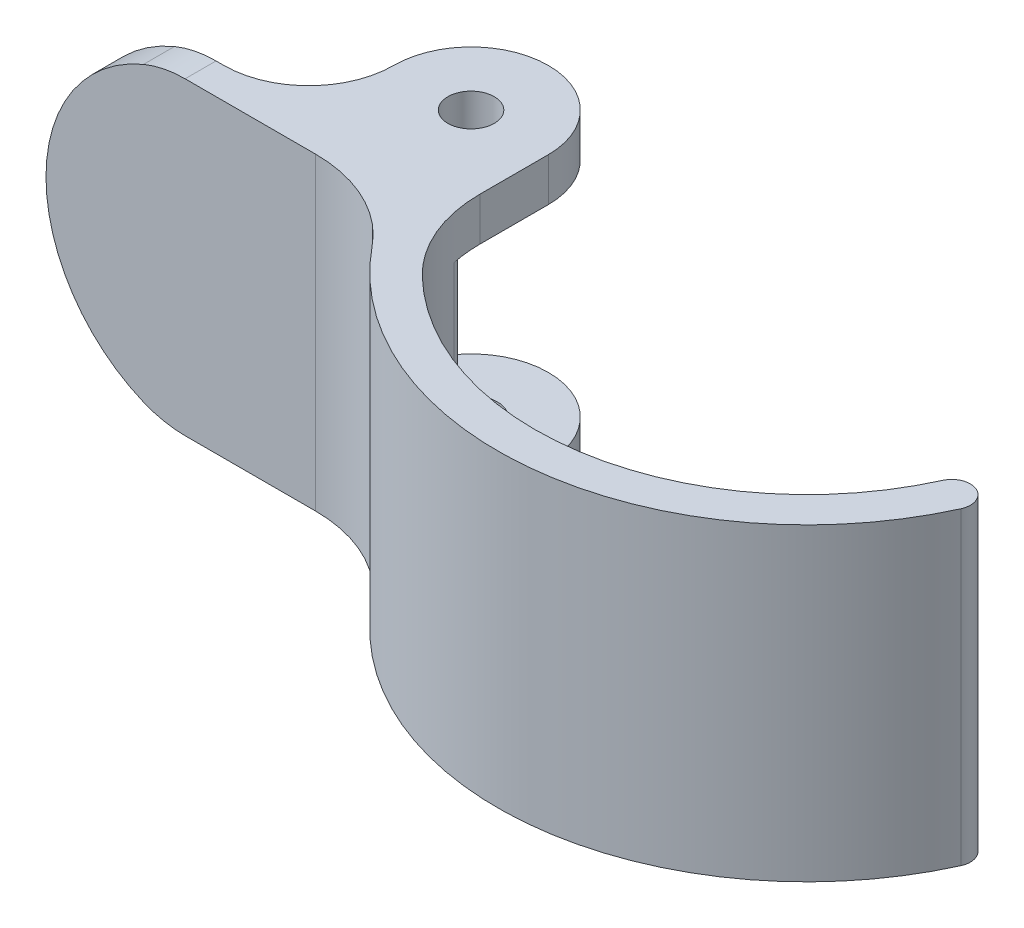
from build123d import *

# Parameters (mm, degrees)
SKETCH1_W                                           = 17
SKETCH1_H                                           = 20
BOSS_EXTRUDE1_DEPTH                                 = 2
SKETCH2_R                                           = 1.5
BOSS_EXTRUDE2_DEPTH                                 = 2.8
FILLET1_R                                           = 5.5
FILLET1_OF_MIRROR1_R                                = 5.5
CSK_FOR_M3_COUNTERSUNK_FLAT_HEAD_SCREW1_D           = 3.4
CSK_FOR_M3_COUNTERSUNK_FLAT_HEAD_SCREW1_DEPTH       = 7
CSK_FOR_M3_COUNTERSUNK_FLAT_HEAD_SCREW1_CSINK_D     = 6.3
CSK_FOR_M3_COUNTERSUNK_FLAT_HEAD_SCREW1_CSINK_ANGLE = 90
CSK_FOR_M3_COUNTERSUNK_FLAT_HEAD_SCREW1_TIP         = 1.021463052
BOSS_EXTRUDE3_DEPTH                                 = 2
FILLET2_R                                           = 7
BOSS_EXTRUDE4_DEPTH                                 = 20
FILLET3_R                                           = 9
FILLET4_R                                           = 9
FILLET5_R                                           = 1


# Some blends are built 0.0001 mm under size
with BuildPart() as part:
    # Sketch1 → Boss-Extrude1 (new body)
    with BuildSketch(Plane.XY):
        with Locations((-3.5, 0)):
            Rectangle(SKETCH1_W, SKETCH1_H)
    extrude(amount=BOSS_EXTRUDE1_DEPTH)

    # Sketch2 → Boss-Extrude2 (add)
    with BuildSketch(Plane(origin=(0, 10, 0), x_dir=(1, 0, 0), z_dir=(0, 1, 0))):
        with BuildLine():
            Line((5, 0), (-5, 0))
            Line((-5, 0), (-5, 5.5))
            ThreePointArc((-5, 5.5), (0, 10.5), (5, 5.5))
            Line((5, 5.5), (5, 0))
        make_face()
        with Locations(Location((0, 5.5, 0), (0, 0, 270))):
            Circle(SKETCH2_R, mode=Mode.SUBTRACT)
    boss_extrude2 = extrude(amount=-BOSS_EXTRUDE2_DEPTH)

    # Fillet1
    fillet1_edges = [part.edges().sort_by_distance(p)[0] for p in [
        (-5, 8.6, 0),
    ]]
    fillet(fillet1_edges, radius=FILLET1_R - 0.0001)  # a hair under: the kernel refuses the full size

    # Mirror1: Boss-Extrude2 across plane
    add(boss_extrude2.mirror(Plane.ZX))

    # Fillet1 of Mirror1
    fillet1_of_mirror1_edges = [part.edges().sort_by_distance(p)[0] for p in [
        (-5, -8.6, 0),
    ]]
    fillet(fillet1_of_mirror1_edges, radius=FILLET1_OF_MIRROR1_R - 0.0001)  # a hair under: the kernel refuses the full size

    # CSK for M3 Countersunk Flat Head Screw1
    with Locations(Plane(origin=(0, -10, 0), x_dir=(-1, 0, 0), z_dir=(0, -1, 0))):
        with Locations((0, 5.5)):
            CounterSinkHole(CSK_FOR_M3_COUNTERSUNK_FLAT_HEAD_SCREW1_D / 2, CSK_FOR_M3_COUNTERSUNK_FLAT_HEAD_SCREW1_CSINK_D / 2, depth=CSK_FOR_M3_COUNTERSUNK_FLAT_HEAD_SCREW1_DEPTH, counter_sink_angle=CSK_FOR_M3_COUNTERSUNK_FLAT_HEAD_SCREW1_CSINK_ANGLE)
            with Locations((0, 0, -(CSK_FOR_M3_COUNTERSUNK_FLAT_HEAD_SCREW1_DEPTH + CSK_FOR_M3_COUNTERSUNK_FLAT_HEAD_SCREW1_TIP / 2))):  # 118° drill point
                Cone(0, CSK_FOR_M3_COUNTERSUNK_FLAT_HEAD_SCREW1_D / 2, CSK_FOR_M3_COUNTERSUNK_FLAT_HEAD_SCREW1_TIP, mode=Mode.SUBTRACT)

    # Sketch5 → Boss-Extrude3 (add)
    with BuildSketch(Plane.XY.offset(2)):
        with BuildLine():
            Line((-12, 10), (-12, -10))
            ThreePointArc((-12, -10), (-20, 0), (-12, 10))
        make_face()
    extrude(amount=-BOSS_EXTRUDE3_DEPTH)

    # Fillet2
    fillet2_edges = [part.edges().sort_by_distance(p)[0] for p in [
        (-12, -10, 1),
        (-12, 10, 1),
    ]]
    fillet(fillet2_edges, radius=FILLET2_R)

    # Sketch6 → Boss-Extrude4 (add)
    with BuildSketch(Plane(origin=(0, 10, 0), x_dir=(1, 0, 0), z_dir=(0, 1, 0))):
        with BuildLine():
            Line((2.239887411, -2), (4.367153275, -0.888811472))
            ThreePointArc((4.367153275, -0.888811472), (20.461428056, -10.333152259), (36, 0))
            ThreePointArc((36, 0), (37.588145554, 0.59815859), (38.186304144, -0.989986964))
            ThreePointArc((38.186304144, -0.989986964), (20.528836027, -12.73220544), (2.239887411, -2))
        make_face()
    extrude(amount=-BOSS_EXTRUDE4_DEPTH)

    # Fillet3
    # the kernel refuses this fillet: 9 mm, written as the material it adds along each edge
    with BuildSketch(Plane(origin=(5, -10, 2), x_dir=(0, 0, -1), z_dir=(0, 1, 0))) as fillet3_piece_1_section:
        with BuildLine():
            CenterArc((3.066869404, -9), FILLET3_R, 90, 46.064417531)
            ThreePointArc((-3.414213733, -2.755357386), (-1.793300325, -1.270874802), (0, 0))
            Line((0, 0), (3.066869404, 0))
        make_face()
    fillet3_piece_1 = extrude(amount=20, mode=Mode.PRIVATE)
    fillet3_piece_1 = split(fillet3_piece_1, bisect_by=Plane(origin=(4.921450274, -8.6, 0), z_dir=(0, 0, -1)), keep=Keep.TOP, mode=Mode.PRIVATE)
    fillet3_piece_1 = split(fillet3_piece_1, bisect_by=Plane(origin=(4.921450274, -7.2, -0.505403298), z_dir=(0, -1, 0)), keep=Keep.TOP, mode=Mode.PRIVATE)
    add(fillet3_piece_1)
    with BuildSketch(Plane(origin=(5, -10, 2), x_dir=(0, 0, -1), z_dir=(0, 1, 0))) as fillet3_piece_2_section:
        with BuildLine():
            CenterArc((3.066869404, -9), FILLET3_R, 90, 46.064417531)
            ThreePointArc((-3.414213733, -2.755357386), (-1.793300325, -1.270874802), (0, 0))
            Line((0, 0), (3.066869404, 0))
        make_face()
    fillet3_piece_2 = extrude(amount=20, mode=Mode.PRIVATE)
    fillet3_piece_2 = split(fillet3_piece_2, bisect_by=Plane(origin=(5.669505966, -8.6, 0), z_dir=(0, 0, 1)), keep=Keep.TOP, mode=Mode.PRIVATE)
    fillet3_piece_2 = split(fillet3_piece_2, bisect_by=Plane(origin=(5.669505966, -7.2, 2.571944176), z_dir=(0, -1, 0)), keep=Keep.TOP, mode=Mode.PRIVATE)
    add(fillet3_piece_2)
    with BuildSketch(Plane(origin=(5, -10, 2), x_dir=(0, 0, -1), z_dir=(0, 1, 0))) as fillet3_piece_3_section:
        with BuildLine():
            CenterArc((3.066869404, -9), FILLET3_R, 90, 46.064417531)
            ThreePointArc((-3.414213733, -2.755357386), (-1.793300325, -1.270874802), (0, 0))
            Line((0, 0), (3.066869404, 0))
        make_face()
    fillet3_piece_3 = extrude(amount=20, mode=Mode.PRIVATE)
    fillet3_piece_3 = split(fillet3_piece_3, bisect_by=Plane(origin=(5.669505966, 0, 0), z_dir=(0, 0, 1)), keep=Keep.TOP, mode=Mode.PRIVATE)
    fillet3_piece_3 = split(fillet3_piece_3, bisect_by=Plane(origin=(5.669505966, 7.2, 2.571944176), z_dir=(0, -1, 0)), keep=Keep.TOP, mode=Mode.PRIVATE)
    fillet3_piece_3 = split(fillet3_piece_3, bisect_by=Plane(origin=(5.669505966, -7.2, 2.571944176), z_dir=(0, 1, 0)), keep=Keep.TOP, mode=Mode.PRIVATE)
    add(fillet3_piece_3)
    with BuildSketch(Plane(origin=(5, -10, 2), x_dir=(0, 0, -1), z_dir=(0, 1, 0))) as fillet3_piece_4_section:
        with BuildLine():
            CenterArc((3.066869404, -9), FILLET3_R, 90, 46.064417531)
            ThreePointArc((-3.414213733, -2.755357386), (-1.793300325, -1.270874802), (0, 0))
            Line((0, 0), (3.066869404, 0))
        make_face()
    fillet3_piece_4 = extrude(amount=20, mode=Mode.PRIVATE)
    fillet3_piece_4 = split(fillet3_piece_4, bisect_by=Plane(origin=(4.921450274, 8.6, 0), z_dir=(0, 0, -1)), keep=Keep.TOP, mode=Mode.PRIVATE)
    fillet3_piece_4 = split(fillet3_piece_4, bisect_by=Plane(origin=(4.921450274, 7.2, -0.505403298), z_dir=(0, 1, 0)), keep=Keep.TOP, mode=Mode.PRIVATE)
    add(fillet3_piece_4)
    with BuildSketch(Plane(origin=(5, -10, 2), x_dir=(0, 0, -1), z_dir=(0, 1, 0))) as fillet3_piece_5_section:
        with BuildLine():
            CenterArc((3.066869404, -9), FILLET3_R, 90, 46.064417531)
            ThreePointArc((-3.414213733, -2.755357386), (-1.793300325, -1.270874802), (0, 0))
            Line((0, 0), (3.066869404, 0))
        make_face()
    fillet3_piece_5 = extrude(amount=20, mode=Mode.PRIVATE)
    fillet3_piece_5 = split(fillet3_piece_5, bisect_by=Plane(origin=(5.669505966, 8.6, 0), z_dir=(0, 0, 1)), keep=Keep.TOP, mode=Mode.PRIVATE)
    fillet3_piece_5 = split(fillet3_piece_5, bisect_by=Plane(origin=(5.669505966, 7.2, 2.571944176), z_dir=(0, 1, 0)), keep=Keep.TOP, mode=Mode.PRIVATE)
    add(fillet3_piece_5)

    # Fillet4
    fillet4_edges = [part.edges().sort_by_distance(p)[0] for p in [
        (2.239887411, 0, 2),
    ]]
    fillet(fillet4_edges, radius=FILLET4_R)

    # Fillet5
    fillet5_edges = [part.edges().sort_by_distance(p)[0] for p in [
        (5.063457622, 0, 0),
    ]]
    fillet(fillet5_edges, radius=FILLET5_R)


solid = part.part
